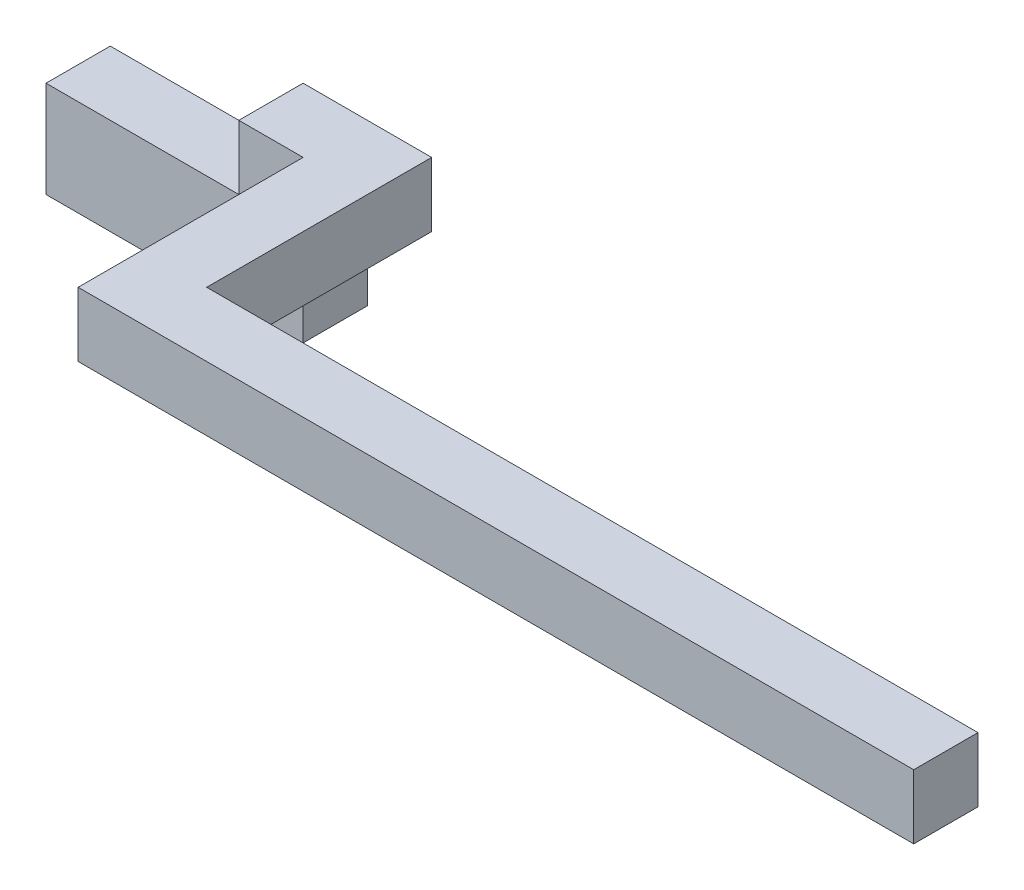
from build123d import *

# Parameters (mm, degrees)
SKETCH1_W           = 431.8
SKETCH1_H           = 63.5
BOSS_EXTRUDE1_DEPTH = 25.4
SKETCH2_W           = 330.2
SKETCH2_H           = 38.1
CUT_EXTRUDE1_DEPTH  = 334.35988061
SKETCH3_W           = 330.2
SKETCH3_H           = 25.4
BOSS_EXTRUDE2_DEPTH = 88.9
SKETCH4_W           = 76.2
SKETCH4_H           = 25.4
CUT_EXTRUDE2_DEPTH  = 345.073916477
SKETCH5_W           = 304.8
SKETCH5_H           = 88.9
CUT_EXTRUDE3_DEPTH  = 356.146138934
HOLE1_D             = 12.7
HOLE1_DEPTH         = 3.302


with BuildPart() as part:
    # Sketch1 → Boss-Extrude1 (new body)
    with BuildSketch(Plane.XY.offset(25.4)):
        with Locations((114.3, -6.35)):
            Rectangle(SKETCH1_W, SKETCH1_H)
    extrude(amount=-BOSS_EXTRUDE1_DEPTH)

    # Sketch2 → Cut-Extrude1 (cut, through all)
    with BuildSketch(Plane(origin=(0, 0, 0), x_dir=(-1, 0, 0), z_dir=(0, 0, -1))):
        with Locations((-165.1, -19.05)):
            Rectangle(SKETCH2_W, SKETCH2_H)
    extrude(amount=-CUT_EXTRUDE1_DEPTH, mode=Mode.SUBTRACT)

    # Sketch3 → Boss-Extrude2 (add)
    with BuildSketch(Plane.XY.offset(25.4)):
        with Locations((165.1, 12.7)):
            Rectangle(SKETCH3_W, SKETCH3_H)
    extrude(amount=BOSS_EXTRUDE2_DEPTH)

    # Sketch4 → Cut-Extrude2 (cut, through all)
    with BuildSketch(Plane.XY.offset(25.4)):
        with Locations((-63.5, 12.7)):
            Rectangle(SKETCH4_W, SKETCH4_H)
    extrude(amount=-CUT_EXTRUDE2_DEPTH, mode=Mode.SUBTRACT)

    # Sketch5 → Cut-Extrude3 (cut, through all)
    with BuildSketch(Plane(origin=(0, 25.4, 0), x_dir=(-1, 0, 0), z_dir=(0, 1, 0))):
        with Locations((-177.8, 44.45)):
            Rectangle(SKETCH5_W, SKETCH5_H)
    extrude(amount=-CUT_EXTRUDE3_DEPTH, mode=Mode.SUBTRACT)

    # Hole1
    with Locations(Plane(origin=(0, 0, 0), x_dir=(-1, 0, 0), z_dir=(0, 0, -1))):
        with Locations((-12.7, 12.7)):
            Hole(HOLE1_D / 2, depth=HOLE1_DEPTH)


solid = part.part
